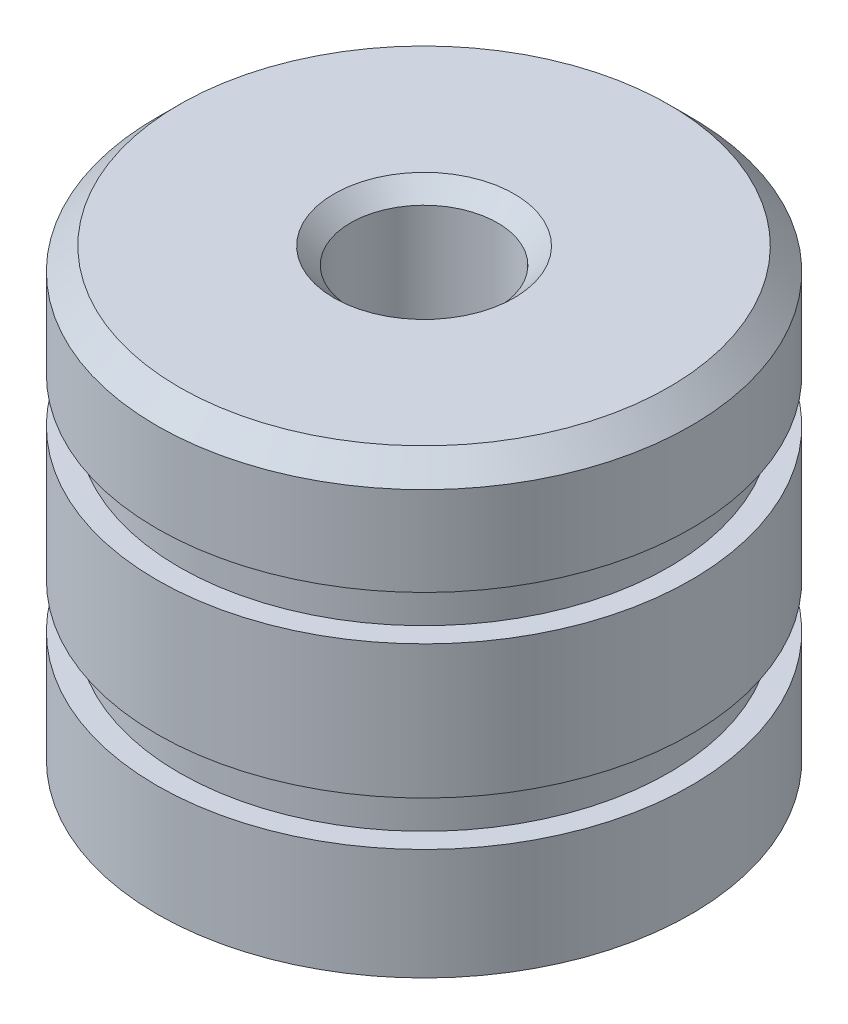
from build123d import *

# Parameters (mm, degrees)
SKETCH1_R                       = 6
BOSS_EXTRUDE1_DEPTH             = 5
CUT_EXTRUDE1_START              = -2.5
SKETCH2_R                       = 6
SKETCH2_R_2                     = 5.5
CUT_EXTRUDE1_DEPTH              = 1
CHAMFER1_SIZE                   = 0.5
M4X0_7_TAPPED_HOLE1_D           = 3.3
M4X0_7_TAPPED_HOLE1_DEPTH       = 8
M4X0_7_TAPPED_HOLE1_CSINK_D     = 4.05
M4X0_7_TAPPED_HOLE1_CSINK_ANGLE = 90
M4X0_7_TAPPED_HOLE1_TIP         = 0.991420021


with BuildPart() as part:
    # Sketch1 → Boss-Extrude1 (new, symmetric)
    with BuildSketch(Plane(origin=(0, 0, 0), x_dir=(1, 0, 0), z_dir=(0, 1, 0))):
        Circle(SKETCH1_R)
    extrude(amount=BOSS_EXTRUDE1_DEPTH, both=True)

    # Sketch2 → Cut-Extrude1 (cut)
    with BuildSketch(Plane(origin=(0, 5, 0), x_dir=(1, 0, 0), z_dir=(0, 1, 0)).offset(CUT_EXTRUDE1_START)):
        Circle(SKETCH2_R)
        Circle(SKETCH2_R_2, mode=Mode.SUBTRACT)
    cut_extrude1 = extrude(amount=-CUT_EXTRUDE1_DEPTH, mode=Mode.SUBTRACT)

    # Mirror1: Cut-Extrude1 across plane
    add(cut_extrude1.mirror(Plane.ZX), mode=Mode.SUBTRACT)

    # Chamfer1
    chamfer1_edges = [part.edges().sort_by_distance(p)[0] for p in [
        (-6, 5, 0),
    ]]
    chamfer(chamfer1_edges, length=CHAMFER1_SIZE)

    # M4x0.7 Tapped Hole1
    with Locations(Plane(origin=(0, 5, 0), x_dir=(1, 0, 0), z_dir=(0, 1, 0))):
        with Locations((0, 0)):
            CounterSinkHole(M4X0_7_TAPPED_HOLE1_D / 2, M4X0_7_TAPPED_HOLE1_CSINK_D / 2, depth=M4X0_7_TAPPED_HOLE1_DEPTH, counter_sink_angle=M4X0_7_TAPPED_HOLE1_CSINK_ANGLE)
            with Locations((0, 0, -(M4X0_7_TAPPED_HOLE1_DEPTH + M4X0_7_TAPPED_HOLE1_TIP / 2))):  # 118° drill point
                Cone(0, M4X0_7_TAPPED_HOLE1_D / 2, M4X0_7_TAPPED_HOLE1_TIP, mode=Mode.SUBTRACT)


solid = part.part
